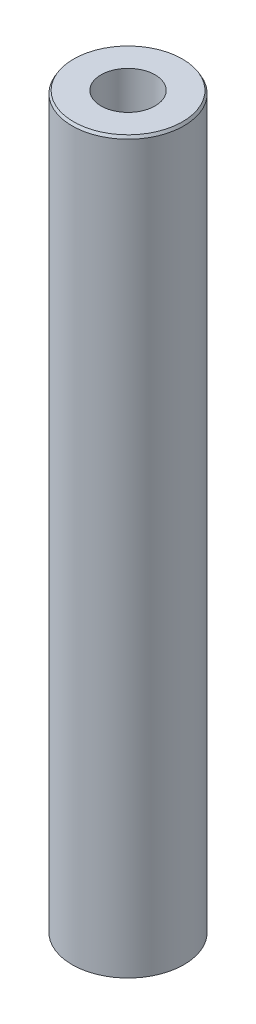
from build123d import *
from OCP.BRepFilletAPI import BRepFilletAPI_MakeChamfer

# Parameters (mm, degrees)
SKETCH1_R           = 42.5
BOSS_EXTRUDE1_DEPTH = 554.642758233
SKETCH2_R           = 20.510029111
CUT_EXTRUDE1_DEPTH  = 558.889854057
CHAMFER1_SIZE       = 2.065305628
CHAMFER1_SIZE2      = 1.19240476


with BuildPart() as part:
    # Sketch1 → Boss-Extrude1 (new body)
    with BuildSketch(Plane(origin=(0, 0, 0), x_dir=(1, 0, 0), z_dir=(0, 1, 0))):
        Circle(SKETCH1_R)
    extrude(amount=BOSS_EXTRUDE1_DEPTH)

    # Sketch2 → Cut-Extrude1 (cut, through all)
    with BuildSketch(Plane(origin=(0, 0, 0), x_dir=(1, 0, 0), z_dir=(0, 1, 0))):
        Circle(SKETCH2_R)
    extrude(amount=CUT_EXTRUDE1_DEPTH, mode=Mode.SUBTRACT)

    # Chamfer1: one chamfer whose edges measure the first distance from different faces: ONE call of the kernel's chamfer builder (chamfer() names one face for all edges)
    chamfer1_edges_1 = [part.edges().sort_by_distance(p)[0] for p in [
        (-42.5, 554.642758233, 0),
    ]]
    chamfer1_side_1 = [part.faces().sort_by_distance(p)[0] for p in [
        (-42.5, 277.321379116, 0),
    ]]
    chamfer1_edges_2 = [part.edges().sort_by_distance(p)[0] for p in [
        (-42.5, 0, 0),
    ]]
    chamfer1_side_2 = [part.faces().sort_by_distance(p)[0] for p in [
        (-41.297918472, 0, 0),
    ]]
    chamfer1 = BRepFilletAPI_MakeChamfer(part.part.solid().wrapped)
    for e in chamfer1_edges_1:
        chamfer1.Add(CHAMFER1_SIZE, CHAMFER1_SIZE2, e.wrapped, chamfer1_side_1[0].wrapped)  # the first distance lies on this face
    for e in chamfer1_edges_2:
        chamfer1.Add(CHAMFER1_SIZE, CHAMFER1_SIZE2, e.wrapped, chamfer1_side_2[0].wrapped)  # the first distance lies on this face
    add(Compound.cast(chamfer1.Shape()), mode=Mode.REPLACE)


solid = part.part
